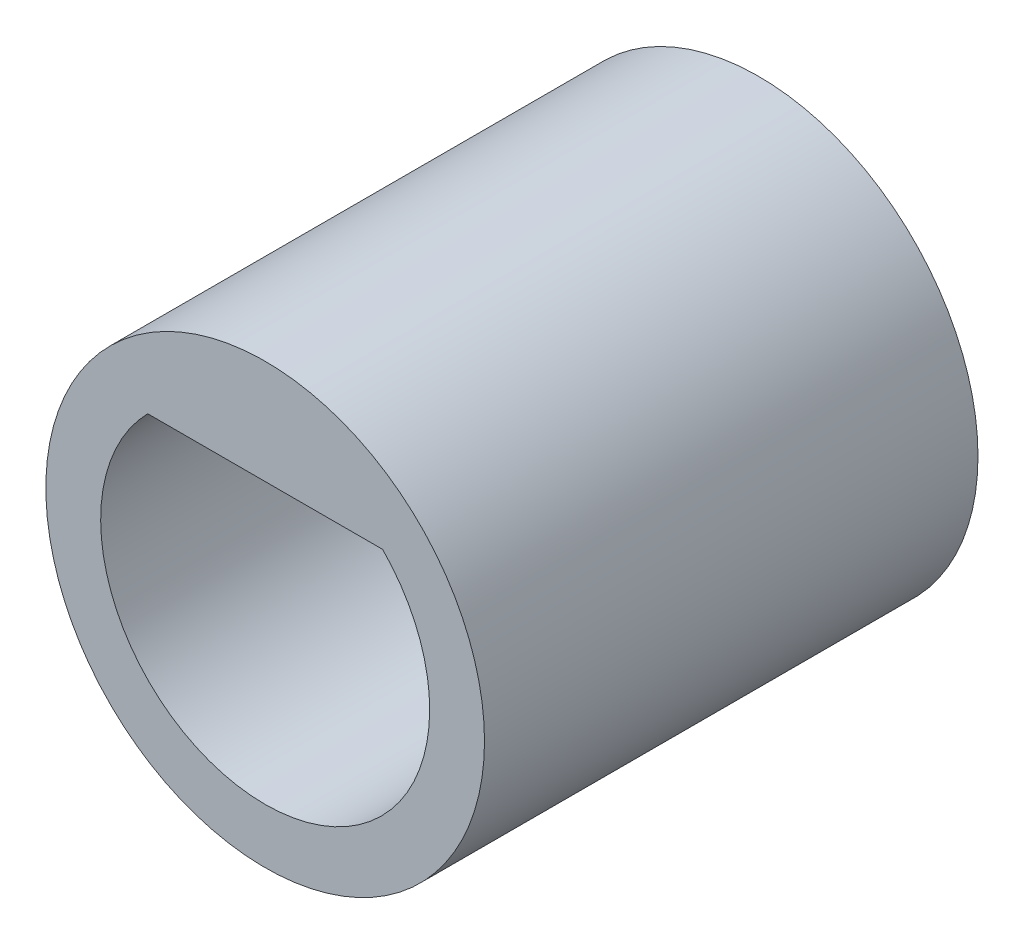
from build123d import *

# Parameters (mm, degrees)
ESQUISSE1_R        = 4
BOSS_EXTRU_1_DEPTH = 9


with BuildPart() as part:
    # Esquisse1 → Boss.-Extru.1 (new body)
    with BuildSketch(Plane.XY):
        Circle(ESQUISSE1_R)
        with BuildLine():
            Line((-2.142428529, 2.1), (2.142428529, 2.1))
            ThreePointArc((2.142428529, 2.1), (0, -3), (-2.142428529, 2.1))
        make_face(mode=Mode.SUBTRACT)
    extrude(amount=BOSS_EXTRU_1_DEPTH)


solid = part.part
